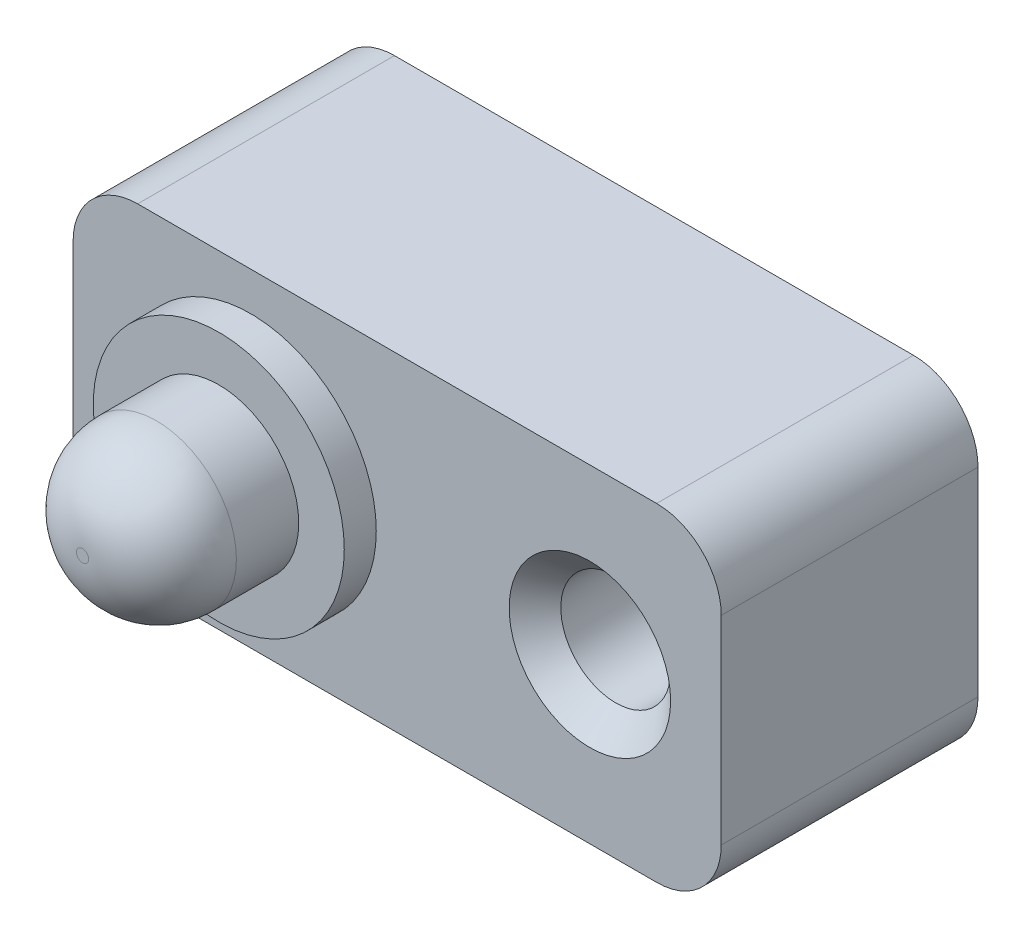
from build123d import *

# Parameters (mm, degrees)
SKETCH1_W                     = 20.066
SKETCH1_H                     = 10.16
BOSS_EXTRUDE1_DEPTH           = 7.9502
SKETCH2_R                     = 3.8862
BOSS_EXTRUDE2_DEPTH           = 0.9906
SKETCH3_R                     = 2.4765
BOSS_EXTRUDE3_DEPTH           = 4.2164
CSK_FOR_M3_SFHCS1_D           = 3.4
CSK_FOR_M3_SFHCS1_CSINK_D     = 5
CSK_FOR_M3_SFHCS1_CSINK_ANGLE = 90
FILLET1_R                     = 2.286
FILLET2_R                     = 2


with BuildPart() as part:
    # Sketch1 → Boss-Extrude1 (new body)
    with BuildSketch(Plane.XY):
        with Locations((10.033, 5.08)):
            Rectangle(SKETCH1_W, SKETCH1_H)
    extrude(amount=BOSS_EXTRUDE1_DEPTH)

    # Sketch2 → Boss-Extrude2 (add)
    with BuildSketch(Plane.XY.offset(7.9502)):
        with Locations((5.5, 5.08)):
            Circle(SKETCH2_R)
    extrude(amount=BOSS_EXTRUDE2_DEPTH)

    # Sketch3 → Boss-Extrude3 (add)
    with BuildSketch(Plane.XY.offset(8.9408)):
        with Locations((5.5, 5.08)):
            Circle(SKETCH3_R)
    extrude(amount=BOSS_EXTRUDE3_DEPTH)

    # CSK for M3 SFHCS1 (through all)
    with Locations(Plane.XY.offset(7.9502)):
        with Locations((16, 5.08)):
            CounterSinkHole(CSK_FOR_M3_SFHCS1_D / 2, CSK_FOR_M3_SFHCS1_CSINK_D / 2, counter_sink_angle=CSK_FOR_M3_SFHCS1_CSINK_ANGLE)

    # Fillet1
    fillet1_edges = [part.edges().sort_by_distance(p)[0] for p in [
        (3.0235, 5.08, 13.1572),
    ]]
    fillet(fillet1_edges, radius=FILLET1_R)

    # Fillet2
    fillet2_edges = [part.edges().sort_by_distance(p)[0] for p in [
        (0, 0, 3.9751),
        (0, 10.16, 3.9751),
        (20.066, 0, 3.9751),
        (20.066, 10.16, 3.9751),
    ]]
    fillet(fillet2_edges, radius=FILLET2_R)


solid = part.part
